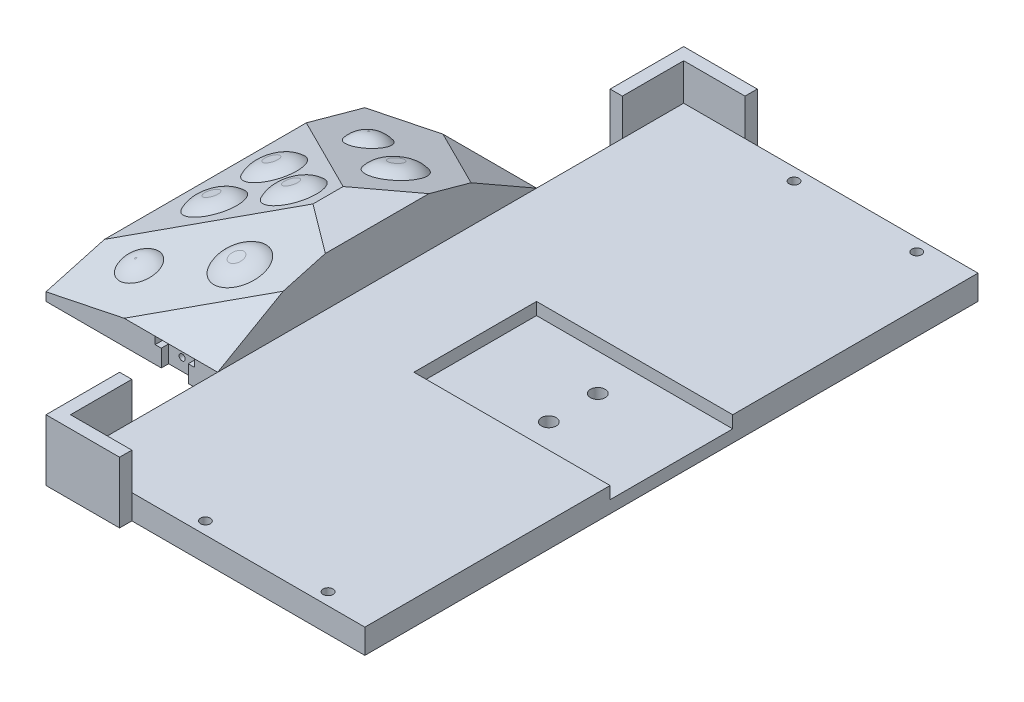
from build123d import *
from OCP.BRepFilletAPI import BRepFilletAPI_MakeChamfer

# Parameters (mm, degrees)
AUFSATZ_LINEAR_AUSTRAGEN1_DEPTH      = 15
SKIZZE2_W                            = 5
SKIZZE2_H                            = 4
SKIZZE2_H_2                          = 3
AUFSATZ_LINEAR_AUSTRAGEN2_DEPTH      = 37
AUFSATZ_LINEAR_AUSTRAGEN3_DEPTH      = 15
SKIZZE4_W                            = 5
SKIZZE4_H                            = 250
AUFSATZ_LINEAR_AUSTRAGEN4_DEPTH      = 15
SKIZZE5_W                            = 30
SKIZZE5_H                            = 5
AUFSATZ_LINEAR_AUSTRAGEN5_DEPTH      = 30
AUFSATZ_LINEAR_AUSTRAGEN6_DEPTH      = 15
AUFSATZ_LINEAR_AUSTRAGEN6_2_DEPTH    = 15
SKIZZE7_W                            = 5
SKIZZE7_H                            = 5
AUFSATZ_LINEAR_AUSTRAGEN7_DEPTH      = 15
AUFSATZ_LINEAR_AUSTRAGEN8_DEPTH      = 15
AUFSATZ_LINEAR_AUSTRAGEN8_DEPTH_BACK = 15
SKIZZE8_W                            = 5
SKIZZE8_H                            = 30.74644599
SKIZZE8_H_2                          = 29.008771532
SKIZZE9_W                            = 5
SKIZZE9_H                            = 5
AUFSATZ_LINEAR_AUSTRAGEN10_DEPTH     = 15
SKIZZE10_W                           = 5
SKIZZE10_H                           = 30
SCHNITT_LINEAR_AUSTRAGEN1_DEPTH      = 1.01
SKIZZE12_W                           = 10.711230156
SKIZZE12_H                           = 5
SKIZZE12_W_2                         = 5
SKIZZE12_H_2                         = 5.74644599
SKIZZE12_H_3                         = 4.008771532
SKIZZE12_W_3                         = 18.406645612
SKIZZE12_H_4                         = 11.130363441
SKIZZE12_W_4                         = 9.588104439
SKIZZE12_H_5                         = 13.193622238
SCHNITT_LINEAR_AUSTRAGEN2_DEPTH      = 15
SKIZZE13_W                           = 10.711230156
SKIZZE13_H                           = 5
SKIZZE13_W_2                         = 9.588104439
SKIZZE13_W_3                         = 5
SKIZZE13_H_2                         = 13.193622238
SKIZZE13_H_3                         = 11.130363441
SKIZZE13_W_4                         = 18.406645612
SCHNITT_LINEAR_AUSTRAGEN3_DEPTH      = 15
SKIZZE14_W                           = 50
SKIZZE14_H                           = 50
SKIZZE14_W_2                         = 20
AUFSATZ_LINEAR_AUSTRAGEN11_DEPTH     = 20
FASE2_SIZE                           = 20
FASE2_SIZE2                          = 50
FASE3_SIZE                           = 20
FASE3_SIZE2                          = 35
FASE4_SIZE                           = 20
SKIZZE15_R                           = 10
SKIZZE15_R_2                         = 7.5
AUFSATZ_LINEAR_AUSTRAGEN12_DEPTH     = 3
VERRUNDUNG1_R                        = 10
SKIZZE18_R                           = 10
SKIZZE18_R_2                         = 7.5
AUFSATZ_LINEAR_AUSTRAGEN13_DEPTH     = 3
VERRUNDUNG2_R                        = 10
SKIZZE19_R                           = 10
AUFSATZ_LINEAR_AUSTRAGEN14_DEPTH     = 3
VERRUNDUNG3_R                        = 10
SKIZZE20_R                           = 1.5
SCHNITT_LINEAR_AUSTRAGEN4_DEPTH      = 250
SKIZZE21_W                           = 4
SKIZZE21_H                           = 7
SKIZZE21_H_2                         = 5.2
SKIZZE21_W_2                         = 41
AUFSATZ_LINEAR_AUSTRAGEN15_DEPTH     = 10
SKIZZE22_R                           = 1.75
SCHNITT_LINEAR_AUSTRAGEN5_DEPTH      = 20
SCHNITT_LINEAR_AUSTRAGEN8_DEPTH      = 50
SCHNITT_LINEAR_AUSTRAGEN8_DEPTH_BACK = 50
SKIZZE25_W                           = 212.967285893
SKIZZE25_H                           = 303.234570009
SKIZZE26_W                           = 50
SKIZZE26_H                           = 5
SCHNITT_LINEAR_AUSTRAGEN9_DEPTH      = 80
SKIZZE28_R                           = 12.5
SCHNITT_LINEAR_AUSTRAGEN10_DEPTH     = 80
SKIZZE29_R                           = 23.129558289
AUFSATZ_LINEAR_AUSTRAGEN16_DEPTH     = 10
SKIZZE33_W                           = 50
SKIZZE33_H                           = 5
AUFSATZ_LINEAR_AUSTRAGEN17_DEPTH     = 160
SKIZZE34_W                           = 160
SKIZZE34_H                           = 50
AUFSATZ_LINEAR_AUSTRAGEN18_DEPTH     = 15
SKIZZE36_R                           = 2.5
SCHNITT_LINEAR_AUSTRAGEN12_DEPTH     = 250
SKIZZE37_R                           = 3
SCHNITT_LINEAR_AUSTRAGEN16_DEPTH     = 78
SKIZZE38_R                           = 2
SCHNITT_LINEAR_AUSTRAGEN17_DEPTH     = 50
SKIZZE39_W                           = 160
SKIZZE39_H                           = 50
SCHNITT_LINEAR_AUSTRAGEN18_DEPTH     = 15
SCHNITT_LINEAR_START                 = -5
SKIZZE40_W                           = 160
SKIZZE40_H                           = 50
SKIZZE40_R                           = 3
SCHNITT_LINEAR_AUSTRAGEN19_DEPTH     = 5
SKIZZE41_R                           = 3
SCHNITT_LINEAR_AUSTRAGEN22_DEPTH     = 10
SKIZZE46_W                           = 65
SKIZZE46_H                           = 5
SKIZZE46_W_2                         = 30
SKIZZE46_W_3                         = 95
SCHNITT_LINEAR_AUSTRAGEN25_DEPTH     = 268
SKIZZE48_W                           = 7
SKIZZE48_H                           = 10
SCHNITT_LINEAR_AUSTRAGEN26_DEPTH     = 33
SKIZZE49_W                           = 7
SKIZZE49_H                           = 10
SCHNITT_LINEAR_AUSTRAGEN28_DEPTH     = 33
SKIZZE50_R                           = 1.65
SCHNITT_LINEAR_AUSTRAGEN31_DEPTH     = 7
SKIZZE52_R                           = 7.40510693
SKIZZE52_R_2                         = 8.306038869
AUFSATZ_LINEAR_AUSTRAGEN31_DEPTH     = 17
SKIZZE53_W                           = 20.840230673
SKIZZE53_H                           = 124
AUFSATZ_LINEAR_AUSTRAGEN34_DEPTH     = 10
SKIZZE54_W                           = 9.5
SKIZZE54_H                           = 3
SKIZZE54_W_2                         = 2.5
SCHNITT_LINEAR_AUSTRAGEN32_DEPTH     = 3
SKIZZE55_W                           = 2.5
SKIZZE55_H                           = 3
SCHNITT_LINEAR_AUSTRAGEN34_DEPTH     = 6
SKIZZE57_R                           = 1.25
SCHNITT_LINEAR_AUSTRAGEN35_DEPTH     = 131
SKIZZE58_W                           = 30.500290538
SKIZZE58_H                           = 110
AUFSATZ_LINEAR_AUSTRAGEN35_DEPTH     = 10
SKIZZE59_R                           = 1.65
SCHNITT_LINEAR_AUSTRAGEN36_DEPTH     = 10
SKIZZE60_W                           = 2
SKIZZE60_H                           = 7
SKIZZE60_H_2                         = 3
SCHNITT_LINEAR_AUSTRAGEN40_DEPTH     = 36
SKIZZE61_W                           = 2
SKIZZE61_H                           = 7
SKIZZE61_H_2                         = 3
SCHNITT_LINEAR_AUSTRAGEN41_DEPTH     = 3


with BuildPart() as part:
    # Skizze1 → Aufsatz-Linear austragen1 (new body)
    with BuildSketch(Plane(origin=(0, 0, 0), x_dir=(1, 0, 0), z_dir=(0, 1, 0))):
        Polygon((-105, 65), (-175, 65), (-175, -65), (-105, -65), (-105, -125), (145, -125), (185, -20), (175, -20), (175, 0), (175, 20), (185, 20), (145, 125), (-105, 125), align=None)
        Polygon((175, 0), (175, 20), (185, 20), (185, 0), (185, -20), (175, -20), align=None)
    extrude(amount=AUFSATZ_LINEAR_AUSTRAGEN1_DEPTH)

    # Skizze2 → Aufsatz-Linear austragen2 (add)
    with BuildSketch(Plane(origin=(0, 15, 0), x_dir=(1, 0, 0), z_dir=(0, 1, 0))):
        with Locations((-122.5, -40)):
            Rectangle(SKIZZE2_W, SKIZZE2_H)
        with Locations((-122.5, 40)):
            Rectangle(SKIZZE2_W, SKIZZE2_H)
        with Locations((-122.5, 63.5)):
            Rectangle(SKIZZE2_W, SKIZZE2_H_2)
        with Locations((-122.5, -63.5)):
            Rectangle(SKIZZE2_W, SKIZZE2_H_2)
    extrude(amount=-AUFSATZ_LINEAR_AUSTRAGEN2_DEPTH)

    # Skizze3 → Aufsatz-Linear austragen3 (add)
    with BuildSketch(Plane(origin=(0, 15, 0), x_dir=(1, 0, 0), z_dir=(0, 1, 0))):
        Polygon((145, -125), (195, -125), (195, 125), (145, 125), (185, 20), (185, -20), align=None)
    extrude(amount=-AUFSATZ_LINEAR_AUSTRAGEN3_DEPTH)

    # Skizze4 → Aufsatz-Linear austragen4 (add)
    with BuildSketch(Plane(origin=(0, 15, 0), x_dir=(1, 0, 0), z_dir=(0, 1, 0))):
        with Locations((197.5, 0)):
            Rectangle(SKIZZE4_W, SKIZZE4_H)
    extrude(amount=-AUFSATZ_LINEAR_AUSTRAGEN4_DEPTH)

    # Skizze5 → Aufsatz-Linear austragen5 (add)
    with BuildSketch(Plane(origin=(0, 15, 0), x_dir=(1, 0, 0), z_dir=(0, 1, 0))):
        with Locations((-90, 122.5)):
            Rectangle(SKIZZE5_W, SKIZZE5_H)
        with Locations((-90, -122.5)):
            Rectangle(SKIZZE5_W, SKIZZE5_H)
    extrude(amount=-AUFSATZ_LINEAR_AUSTRAGEN5_DEPTH)



with BuildPart() as body_2:
    # Skizze6 → Aufsatz-Linear austragen6 (new body)
    with BuildSketch(Plane(origin=(0, 15, 0), x_dir=(1, 0, 0), z_dir=(0, 1, 0))):
        Polygon((-61.593354388, 130), (-110, 130), (-110, 88.869636559), (-105, 88.869636559), (-105, 125), (-61.593354388, 125), align=None)
    extrude(amount=AUFSATZ_LINEAR_AUSTRAGEN6_DEPTH)


with BuildPart() as body_3:
    # Skizze6 → Aufsatz-Linear austragen6 2 (new body)
    with BuildSketch(Plane(origin=(0, 15, 0), x_dir=(1, 0, 0), z_dir=(0, 1, 0))):
        Polygon((-110, -86.806377762), (-110, -130), (-70.411895561, -130), (-70.411895561, -125), (-105, -125), (-105, -86.806377762), align=None)
    extrude(amount=AUFSATZ_LINEAR_AUSTRAGEN6_2_DEPTH)


with BuildPart() as part_1:
    add(part.part)

    add(body_2.part)  # Aufsatz-Linear austragen7 merges body 2

    add(body_3.part)  # Aufsatz-Linear austragen7 merges body 3
    # Skizze7 → Aufsatz-Linear austragen7 (add)
    with BuildSketch(Plane.XZ):
        Polygon((-110, -88.869636559), (-110, -125), (-105, -125), (-105, -120), (-105, -88.869636559), align=None)
        with Locations((-107.5, -127.5)):
            Rectangle(SKIZZE7_W, SKIZZE7_H)
        Polygon((-105, -125), (-105, -130), (-61.593354388, -130), (-61.593354388, -125), (-75, -125), align=None)
        Polygon((-105, 125), (-110, 125), (-110, 86.806377762), (-105, 86.806377762), (-105, 120), align=None)
        with Locations((-107.5, 127.5)):
            Rectangle(SKIZZE7_W, SKIZZE7_H)
        Polygon((-70.411895561, 130), (-105, 130), (-105, 125), (-75, 125), (-70.411895561, 125), align=None)
    extrude(amount=-AUFSATZ_LINEAR_AUSTRAGEN7_DEPTH)

    # Skizze8 → Aufsatz-Linear austragen8 (add, two sides: drawn at the far end of the back side and taken through both)
    with BuildSketch(Plane(origin=(0, 15, 0), x_dir=(1, 0, 0), z_dir=(0, 1, 0)).offset(-AUFSATZ_LINEAR_AUSTRAGEN8_DEPTH_BACK)):
        with Locations((147.5, -109.626777005)):
            Rectangle(SKIZZE8_W, SKIZZE8_H)
        Polygon((145, -125), (109.288769844, -125), (109.288769844, -130), (150, -130), (150, -125), align=None)
        with Locations((147.5, 110.495614234)):
            Rectangle(SKIZZE8_W, SKIZZE8_H_2)
        Polygon((118.994620346, 130), (118.994620346, 125), (145, 125), (150, 125), (150, 130), align=None)
    extrude(amount=AUFSATZ_LINEAR_AUSTRAGEN8_DEPTH + AUFSATZ_LINEAR_AUSTRAGEN8_DEPTH_BACK)

    # Skizze9 → Aufsatz-Linear austragen10 (add)
    with BuildSketch(Plane(origin=(0, 15, 0), x_dir=(1, 0, 0), z_dir=(0, 1, 0))):
        Polygon((145, 4), (150, 4), (150, 9), (150, 14), (145, 14), align=None)
        with Locations((152.5, 6.5)):
            Rectangle(SKIZZE9_W, SKIZZE9_H)
        Polygon((190, 4), (200, 4), (200, 14), (196, 14), (196, 9), (190, 9), align=None)
        Polygon((196, 105), (200, 105), (200, 125), (150, 125), (150, 120), (196, 120), align=None)
    extrude(amount=AUFSATZ_LINEAR_AUSTRAGEN10_DEPTH)

    # Skizze10 → Schnitt-Linear austragen1 (cut)
    with BuildSketch(Plane.ZY.offset(-118.994620346)):
        with Locations((-127.5, 15)):
            Rectangle(SKIZZE10_W, SKIZZE10_H)
    extrude(amount=-SCHNITT_LINEAR_AUSTRAGEN1_DEPTH, mode=Mode.SUBTRACT)

    # Skizze12 → Schnitt-Linear austragen2 (cut)
    with BuildSketch(Plane(origin=(0, 15, 0), x_dir=(1, 0, 0), z_dir=(0, 1, 0))):
        with Locations((114.644384922, -127.5)):
            Rectangle(SKIZZE12_W, SKIZZE12_H)
        with Locations((147.5, -97.126777005)):
            Rectangle(SKIZZE12_W_2, SKIZZE12_H_2)
        with Locations((147.5, 97.995614234)):
            Rectangle(SKIZZE12_W_2, SKIZZE12_H_3)
        with Locations((-70.796677194, 127.5)):
            Rectangle(SKIZZE12_W_3, SKIZZE12_H)
        with Locations((-107.5, 94.43481828)):
            Rectangle(SKIZZE12_W_2, SKIZZE12_H_4)
        with Locations((-75.20594778, -127.5)):
            Rectangle(SKIZZE12_W_4, SKIZZE12_H)
        with Locations((-107.5, -93.403188881)):
            Rectangle(SKIZZE12_W_2, SKIZZE12_H_5)
    extrude(amount=SCHNITT_LINEAR_AUSTRAGEN2_DEPTH, mode=Mode.SUBTRACT)

    # Skizze13 → Schnitt-Linear austragen3 (cut)
    with BuildSketch(Plane(origin=(0, 15, 0), x_dir=(1, 0, 0), z_dir=(0, 1, 0))):
        with Locations((114.644384922, -127.5)):
            Rectangle(SKIZZE13_W, SKIZZE13_H)
        with Locations((-75.20594778, -127.5)):
            Rectangle(SKIZZE13_W_2, SKIZZE13_H)
        with Locations((-107.5, -93.403188881)):
            Rectangle(SKIZZE13_W_3, SKIZZE13_H_2)
        with Locations((-107.5, 94.43481828)):
            Rectangle(SKIZZE13_W_3, SKIZZE13_H_3)
        with Locations((-70.796677194, 127.5)):
            Rectangle(SKIZZE13_W_4, SKIZZE13_H)
    extrude(amount=-SCHNITT_LINEAR_AUSTRAGEN3_DEPTH, mode=Mode.SUBTRACT)

    # Skizze14 → Aufsatz-Linear austragen11 (add)
    with BuildSketch(Plane(origin=(0, 15, 0), x_dir=(1, 0, 0), z_dir=(0, 1, 0))):
        Polygon((-175, -25), (-175, -65), (-105, -65), (-105, -25), (-125, -25), align=None)
        with Locations((-150, 0)):
            Rectangle(SKIZZE14_W, SKIZZE14_H)
        with Locations((-115, 0)):
            Rectangle(SKIZZE14_W_2, SKIZZE14_H)
        Polygon((-175, 65), (-175, 25), (-125, 25), (-105, 25), (-105, 65), align=None)
    extrude(amount=AUFSATZ_LINEAR_AUSTRAGEN11_DEPTH)

    # Fase2
    fase2_edges = [part_1.edges().sort_by_distance(p)[0] for p in [
        (-175, 35, 0),
    ]]
    fase2_side = [part_1.faces().sort_by_distance(p)[0] for p in [
        (-175, 17.5, 0),
    ]]
    chamfer(fase2_edges, length=FASE2_SIZE, length2=FASE2_SIZE2, reference=fase2_side[0])

    # Fase3: one chamfer whose edges measure the first distance from different faces: ONE call of the kernel's chamfer builder (chamfer() names one face for all edges)
    fase3_edges_1 = [part_1.edges().sort_by_distance(p)[0] for p in [
        (-115, 35, -65),
    ]]
    fase3_side_1 = [part_1.faces().sort_by_distance(p)[0] for p in [
        (-134.615695793, 13.348705502, -65),
    ]]
    fase3_edges_2 = [part_1.edges().sort_by_distance(p)[0] for p in [
        (-115, 35, 65),
    ]]
    fase3_side_2 = [part_1.faces().sort_by_distance(p)[0] for p in [
        (-134.615695793, 13.348705502, 65),
    ]]
    fase3 = BRepFilletAPI_MakeChamfer(part_1.part.solid().wrapped)
    for e in fase3_edges_1:
        fase3.Add(FASE3_SIZE, FASE3_SIZE2, e.wrapped, fase3_side_1[0].wrapped)  # the first distance lies on this face
    for e in fase3_edges_2:
        fase3.Add(FASE3_SIZE, FASE3_SIZE2, e.wrapped, fase3_side_2[0].wrapped)  # the first distance lies on this face
    add(Compound.cast(fase3.Shape()), mode=Mode.REPLACE)

    # Fase4
    fase4_edges = [part_1.edges().sort_by_distance(p)[0] for p in [
        (-150, 25, 47.5),
        (-150, 25, -47.5),
    ]]
    chamfer(fase4_edges, length=FASE4_SIZE)

    # Skizze15 → Aufsatz-Linear austragen12 (add)
    with BuildSketch(Plane(origin=(-11.551963806, 55.886277719, -15.432210402), x_dir=(0.9807222582245502, 0.18835756766165584, -0.05201229592628623), z_dir=(-0.19540688888301463, 0.9453426139004438, -0.2610430809673718))):
        with Locations(Location((-117.284914164, 20.601047932, 0), (0, 0, 270))):
            Circle(SKIZZE15_R)
        with Locations(Location((-142.839757147, 36.315690789, 0), (0, 0, 270))):
            Circle(SKIZZE15_R_2)
    extrude(amount=AUFSATZ_LINEAR_AUSTRAGEN12_DEPTH)

    # Verrundung1
    # the kernel refuses this fillet: 10 mm, written as the material it takes off along each edge
    with BuildSketch(Plane(origin=(-127.162110348, 31.147334465, -29.972945243), x_dir=(0, 0.26617432079083353, 0.963924909394678), z_dir=(-0.9807222582245501, -0.18835756766165582, 0.052012295926286305))) as verrundung1_piece_1:
        with BuildLine():
            CenterArc((2.858571571, -10), VERRUNDUNG1_R, 44.427004001, 45.572995999)
            Line((2.858571571, 0), (2.858571571, 0.2))
            Line((2.858571571, 0.2), (10, 0.2))
            Line((10, 0.2), (10.2, 0))
            ThreePointArc((10.2, 0), (10.2, -1.5), (10.142828569, -2.86))
            Line((10.142828569, -2.86), (10, -3))
        make_face()
    revolve(axis=Axis((-127.162110348, 31.147334465, -29.972945243), (-0.19540688888301466, 0.9453426139004438, -0.2610430809673718)), mode=Mode.SUBTRACT)
    with BuildSketch(Plane(origin=(-152.224313666, 22.15105201, -43.791514879), x_dir=(0, 0.26617432079083364, 0.9639249093946781), z_dir=(-0.9807222582245503, -0.18835756766165584, 0.052012295926286325))) as verrundung1_piece_2:
        with BuildLine():
            CenterArc((0.358571571, -10), VERRUNDUNG1_R, 44.427004001, 45.572995999)
            Line((0.358571571, 0), (0.358571571, 0.2))
            Line((0.358571571, 0.2), (7.5, 0.2))
            Line((7.5, 0.2), (7.7, 0))
            ThreePointArc((7.7, 0), (7.7, -1.5), (7.642828569, -2.86))
            Line((7.642828569, -2.86), (7.5, -3))
        make_face()
    revolve(axis=Axis((-152.224313666, 22.15105201, -43.791514879), (-0.19540688888301466, 0.9453426139004438, -0.2610430809673718)), mode=Mode.SUBTRACT)

    # Skizze18 → Aufsatz-Linear austragen13 (add)
    with BuildSketch(Plane(origin=(-11.551963806, 55.886277719, 15.432210402), x_dir=(0.9807222582245502, 0.18835756766165587, 0.05201229592628629), z_dir=(-0.19540688888301466, 0.9453426139004437, 0.261043080967372))):
        with Locations(Location((-117.284914164, -25.97894302, 0), (0, 0, 270))):
            Circle(SKIZZE18_R)
        with Locations(Location((-147.284914164, -39.72137923, 0), (0, 0, 270))):
            Circle(SKIZZE18_R_2)
    extrude(amount=AUFSATZ_LINEAR_AUSTRAGEN13_DEPTH)

    # Verrundung2
    # the kernel refuses this fillet: 10 mm, written as the material it takes off along each edge
    with BuildSketch(Plane(origin=(-127.162110348, 29.715876892, 35.156832279), x_dir=(0, -0.26617432079083353, 0.963924909394678), z_dir=(-0.98072225822455, -0.1883575676616558, -0.0520122959262863))) as verrundung2_piece_1:
        with BuildLine():
            CenterArc((2.858571571, -10), VERRUNDUNG2_R, 44.427004001, 45.572995999)
            Line((2.858571571, 0), (2.858571571, 0.2))
            Line((2.858571571, 0.2), (10, 0.2))
            Line((10, 0.2), (10.2, 0))
            ThreePointArc((10.2, 0), (10.2, -1.5), (10.142828569, -2.86))
            Line((10.142828569, -2.86), (10, -3))
        make_face()
    revolve(axis=Axis((-127.162110348, 29.715876892, 35.156832279), (-0.19540688888301463, 0.9453426139004436, 0.26104308096737205)), mode=Mode.SUBTRACT)
    with BuildSketch(Plane(origin=(-156.583778094, 20.407266239, 46.843139979), x_dir=(0, -0.26617432079083425, 0.9639249093946779), z_dir=(-0.9807222582245501, -0.18835756766165576, -0.05201229592628644))) as verrundung2_piece_2:
        with BuildLine():
            CenterArc((0.358571571, -10), VERRUNDUNG2_R, 44.427004001, 45.572995999)
            Line((0.358571571, 0), (0.358571571, 0.2))
            Line((0.358571571, 0.2), (7.5, 0.2))
            Line((7.5, 0.2), (7.7, 0))
            ThreePointArc((7.7, 0), (7.7, -1.5), (7.642828569, -2.86))
            Line((7.642828569, -2.86), (7.5, -3))
        make_face()
    revolve(axis=Axis((-156.583778094, 20.407266239, 46.843139979), (-0.19540688888301463, 0.9453426139004436, 0.26104308096737205)), mode=Mode.SUBTRACT)

    # Skizze19 → Aufsatz-Linear austragen14 (add)
    with BuildSketch(Plane(origin=(-29.310344828, 73.275862069, 0), x_dir=(0.9284766908852605, 0.371390676354101, 0), z_dir=(-0.371390676354101, 0.9284766908852605, 0))):
        with Locations(Location((-118.060912688, -0.063197478, 0), (0, 0, 180))):
            Circle(SKIZZE19_R)
        with Locations(Location((-139.860763151, 12.174715734, 0), (0, 0, 180))):
            Circle(SKIZZE19_R)
        with Locations(Location((-139.91256076, -12.208380744, 0), (0, 0, 180))):
            Circle(SKIZZE19_R)
    extrude(amount=AUFSATZ_LINEAR_AUSTRAGEN14_DEPTH)

    # Verrundung3
    # the kernel refuses this fillet: 10 mm, written as the material it takes off along each edge
    with BuildSketch(Plane(origin=(-140.041322392, 32.214569927, 0.063197478), x_dir=(-0.9284766908852606, -0.37139067635410067, 0), z_dir=(0, 0, -1))) as verrundung3_piece_1:
        with BuildLine():
            CenterArc((2.858571571, -10), VERRUNDUNG3_R, 44.427004001, 45.572995999)
            Line((2.858571571, 0), (2.858571571, 0.2))
            Line((2.858571571, 0.2), (10, 0.2))
            Line((10, 0.2), (10.2, 0))
            ThreePointArc((10.2, 0), (10.2, -1.5), (10.142828569, -2.86))
            Line((10.142828569, -2.86), (10, -3))
        make_face()
    revolve(axis=Axis((-140.041322392, 32.214569927, 0.063197478), (-0.371390676354101, 0.9284766908852605, 0)), mode=Mode.SUBTRACT)
    with BuildSketch(Plane(origin=(-160.281975412, 24.11830872, -12.174715734), x_dir=(-0.9284766908852602, -0.37139067635410167, 0), z_dir=(0, 0, -1))) as verrundung3_piece_2:
        with BuildLine():
            CenterArc((2.858571571, -10), VERRUNDUNG3_R, 44.427004001, 45.572995999)
            Line((2.858571571, 0), (2.858571571, 0.2))
            Line((2.858571571, 0.2), (10, 0.2))
            Line((10, 0.2), (10.2, 0))
            ThreePointArc((10.2, 0), (10.2, -1.5), (10.142828569, -2.86))
            Line((10.142828569, -2.86), (10, -3))
        make_face()
    revolve(axis=Axis((-160.281975412, 24.11830872, -12.174715734), (-0.371390676354101, 0.9284766908852605, 0)), mode=Mode.SUBTRACT)
    with BuildSketch(Plane(origin=(-160.330068284, 24.099071571, 12.208380744), x_dir=(-0.9284766908852602, -0.37139067635410167, 0), z_dir=(0, 0, -1))) as verrundung3_piece_3:
        with BuildLine():
            CenterArc((2.858571571, -10), VERRUNDUNG3_R, 44.427004001, 45.572995999)
            Line((2.858571571, 0), (2.858571571, 0.2))
            Line((2.858571571, 0.2), (10, 0.2))
            Line((10, 0.2), (10.2, 0))
            ThreePointArc((10.2, 0), (10.2, -1.5), (10.142828569, -2.86))
            Line((10.142828569, -2.86), (10, -3))
        make_face()
    revolve(axis=Axis((-160.330068284, 24.099071571, 12.208380744), (-0.371390676354101, 0.9284766908852605, 0)), mode=Mode.SUBTRACT)

    # Skizze20 → Schnitt-Linear austragen4 (cut)
    with BuildSketch(Plane(origin=(0, 0, -65), x_dir=(-1, 0, 0), z_dir=(0, 0, -1))):
        with Locations(Location((122.5, -19.5, 0), (0, 0, 180))):
            Circle(SKIZZE20_R)
        with Locations(Location((122.5, -2.5, 0), (0, 0, 180))):
            Circle(SKIZZE20_R)
    extrude(amount=-SCHNITT_LINEAR_AUSTRAGEN4_DEPTH, mode=Mode.SUBTRACT)

    # Skizze21 → Aufsatz-Linear austragen15 (add)
    with BuildSketch(Plane(origin=(0, 15, 0), x_dir=(1, 0, 0), z_dir=(0, 1, 0))):
        Polygon((145, -100), (150, -100), (191, -100), (191, -93), (145, -93), align=None)
        with Locations((193, -96.5)):
            Rectangle(SKIZZE21_W, SKIZZE21_H)
        with Locations((193, -102.6)):
            Rectangle(SKIZZE21_W, SKIZZE21_H_2)
        with Locations((170.5, -121.5)):
            Rectangle(SKIZZE21_W_2, SKIZZE21_H)
        with Locations((193, -121.5)):
            Rectangle(SKIZZE21_W, SKIZZE21_H)
        with Locations((193, -115.4)):
            Rectangle(SKIZZE21_W, SKIZZE21_H_2)
    extrude(amount=AUFSATZ_LINEAR_AUSTRAGEN15_DEPTH)

    # Skizze22 → Schnitt-Linear austragen5 (cut)
    with BuildSketch(Plane(origin=(0, 15, 0), x_dir=(1, 0, 0), z_dir=(0, 1, 0))):
        with Locations(Location((146.069548912, -58.232980191, 0), (0, 0, 270))):
            Circle(SKIZZE22_R)
        with Locations(Location((146.069548912, -13.432980191, 0), (0, 0, 270))):
            Circle(SKIZZE22_R)
        with Locations(Location((185.869548912, -58.232980191, 0), (0, 0, 270))):
            Circle(SKIZZE22_R)
        with Locations(Location((185.869548912, -13.432980191, 0), (0, 0, 270))):
            Circle(SKIZZE22_R)
    extrude(amount=-SCHNITT_LINEAR_AUSTRAGEN5_DEPTH, mode=Mode.SUBTRACT)

    # Skizze25 → Schnitt-Linear austragen8 (cut, two sides: drawn at the far end of the back side and taken through both)
    with BuildSketch(Plane(origin=(0, 15, 0), x_dir=(1, 0, 0), z_dir=(0, 1, 0)).offset(-SCHNITT_LINEAR_AUSTRAGEN8_DEPTH_BACK)):
        with Locations((121.483642947, -4.738977069)):
            Rectangle(SKIZZE25_W, SKIZZE25_H)
    extrude(amount=SCHNITT_LINEAR_AUSTRAGEN8_DEPTH + SCHNITT_LINEAR_AUSTRAGEN8_DEPTH_BACK, mode=Mode.SUBTRACT)

    # Skizze26 → Schnitt-Linear austragen9 (cut)
    with BuildSketch(Plane(origin=(15, 0, 0), x_dir=(0, 0, -1), z_dir=(1, 0, 0))):
        with Locations((0, 12.5)):
            Rectangle(SKIZZE26_W, SKIZZE26_H)
    extrude(amount=-SCHNITT_LINEAR_AUSTRAGEN9_DEPTH, mode=Mode.SUBTRACT)

    # Skizze28 → Schnitt-Linear austragen10 (cut)
    with BuildSketch(Plane(origin=(0, 10, 0), x_dir=(1, 0, 0), z_dir=(0, 1, 0))):
        with Locations(Location((-35, 0, 0), (0, 0, 270))):
            Circle(SKIZZE28_R)
    extrude(amount=-SCHNITT_LINEAR_AUSTRAGEN10_DEPTH, mode=Mode.SUBTRACT)

    # Skizze29 → Aufsatz-Linear austragen16 (add)
    with BuildSketch(Plane(origin=(0, 0, 0), x_dir=(-1, 0, 0), z_dir=(0, -1, 0))):
        with Locations((35, 0)):
            Circle(SKIZZE29_R)
    extrude(amount=-AUFSATZ_LINEAR_AUSTRAGEN16_DEPTH)

    # Skizze33 → Aufsatz-Linear austragen17 (add)
    with BuildSketch(Plane(origin=(-65, 0, 0), x_dir=(0, 0, -1), z_dir=(1, 0, 0))):
        with Locations((0, 12.5)):
            Rectangle(SKIZZE33_W, SKIZZE33_H)
    extrude(amount=AUFSATZ_LINEAR_AUSTRAGEN17_DEPTH)

    # Skizze34 → Aufsatz-Linear austragen18 (add)
    with BuildSketch(Plane(origin=(0, 0, 0), x_dir=(-1, 0, 0), z_dir=(0, -1, 0))):
        with Locations((-15, 0)):
            Rectangle(SKIZZE34_W, SKIZZE34_H)
    extrude(amount=AUFSATZ_LINEAR_AUSTRAGEN18_DEPTH)

    # Skizze36 → Schnitt-Linear austragen12 (cut)
    with BuildSketch(Plane.XY.offset(125)):
        with Locations((-97.5, -7.5)):
            Circle(SKIZZE36_R)
        with Locations((-82.5, -7.5)):
            Circle(SKIZZE36_R)
    extrude(amount=-SCHNITT_LINEAR_AUSTRAGEN12_DEPTH, mode=Mode.SUBTRACT)

    # Skizze37 → Schnitt-Linear austragen16 (cut)
    with BuildSketch(Plane(origin=(0, 15, 0), x_dir=(1, 0, 0), z_dir=(0, 1, 0))):
        with Locations(Location((35, -10, 0), (0, 0, 270))):
            Circle(SKIZZE37_R)
        with Locations(Location((35, 10, 0), (0, 0, 270))):
            Circle(SKIZZE37_R)
        with Locations(Location((75, -10, 0), (0, 0, 270))):
            Circle(SKIZZE37_R)
        with Locations(Location((75, 10, 0), (0, 0, 270))):
            Circle(SKIZZE37_R)
    extrude(amount=-SCHNITT_LINEAR_AUSTRAGEN16_DEPTH, mode=Mode.SUBTRACT)

    # Skizze38 → Schnitt-Linear austragen17 (cut)
    with BuildSketch(Plane(origin=(0, 15, 0), x_dir=(1, 0, 0), z_dir=(0, 1, 0))):
        with Locations(Location((-55, -120, 0), (0, 0, 270))):
            Circle(SKIZZE38_R)
        with Locations(Location((-5, -120, 0), (0, 0, 270))):
            Circle(SKIZZE38_R)
        with Locations(Location((-5, 120, 0), (0, 0, 270))):
            Circle(SKIZZE38_R)
        with Locations(Location((-55, 120, 0), (0, 0, 270))):
            Circle(SKIZZE38_R)
    extrude(amount=-SCHNITT_LINEAR_AUSTRAGEN17_DEPTH, mode=Mode.SUBTRACT)

    # Skizze39 → Schnitt-Linear austragen18 (cut)
    with BuildSketch(Plane(origin=(0, -15, 0), x_dir=(-1, 0, 0), z_dir=(0, -1, 0))):
        with Locations((-15, 0)):
            Rectangle(SKIZZE39_W, SKIZZE39_H)
    extrude(amount=-SCHNITT_LINEAR_AUSTRAGEN18_DEPTH, mode=Mode.SUBTRACT)

    # Skizze40 → Schnitt-Linear austragen19 (cut)
    with BuildSketch(Plane.XZ.offset(-10).offset(SCHNITT_LINEAR_START)):
        with Locations((15, 0)):
            Rectangle(SKIZZE40_W, SKIZZE40_H)
        with Locations((35, -10)):
            Circle(SKIZZE40_R, mode=Mode.SUBTRACT)
        with Locations((75, -10)):
            Circle(SKIZZE40_R, mode=Mode.SUBTRACT)
    extrude(amount=SCHNITT_LINEAR_AUSTRAGEN19_DEPTH, mode=Mode.SUBTRACT)

    # Skizze41 → Schnitt-Linear austragen22 (cut)
    with BuildSketch(Plane(origin=(0, 10, 0), x_dir=(1, 0, 0), z_dir=(0, 1, 0))):
        with Locations(Location((-25, -10, 0), (0, 0, 270))):
            Circle(SKIZZE41_R)
        with Locations(Location((-25, 10, 0), (0, 0, 270))):
            Circle(SKIZZE41_R)
    extrude(amount=-SCHNITT_LINEAR_AUSTRAGEN22_DEPTH, mode=Mode.SUBTRACT)

    # Skizze46 → Schnitt-Linear austragen25 (cut)
    with BuildSketch(Plane.XY.offset(130)):
        with Locations((-142.5, 2.5)):
            Rectangle(SKIZZE46_W, SKIZZE46_H)
        Polygon((-110, 0), (-175, 0), (-175, -27.405237196), (16.713519916, -27.405237196), (16.713519916, 5), (15, 5), (15, 0), (-80, 0), align=None)
        with Locations((-95, 2.5)):
            Rectangle(SKIZZE46_W_2, SKIZZE46_H)
        with Locations((-32.5, 2.5)):
            Rectangle(SKIZZE46_W_3, SKIZZE46_H)
    extrude(amount=-SCHNITT_LINEAR_AUSTRAGEN25_DEPTH, mode=Mode.SUBTRACT)

    # Skizze48 → Schnitt-Linear austragen26 (cut)
    with BuildSketch(Plane.XY.offset(65)):
        with Locations((-122.5, 10)):
            Rectangle(SKIZZE48_W, SKIZZE48_H)
    extrude(amount=-SCHNITT_LINEAR_AUSTRAGEN26_DEPTH, mode=Mode.SUBTRACT)

    # Skizze49 → Schnitt-Linear austragen28 (cut)
    with BuildSketch(Plane(origin=(0, 0, -65), x_dir=(-1, 0, 0), z_dir=(0, 0, -1))):
        with Locations((122.5, 10)):
            Rectangle(SKIZZE49_W, SKIZZE49_H)
    extrude(amount=-SCHNITT_LINEAR_AUSTRAGEN28_DEPTH, mode=Mode.SUBTRACT)

    # Skizze50 → Schnitt-Linear austragen31 (cut)
    with BuildSketch(Plane.XZ.offset(-15)):
        with Locations(Location((-122.5, -44, 0), (0, 0, 270))):
            Circle(SKIZZE50_R)
        with Locations(Location((-122.5, 44, 0), (0, 0, 270))):
            Circle(SKIZZE50_R)
    extrude(amount=-SCHNITT_LINEAR_AUSTRAGEN31_DEPTH, mode=Mode.SUBTRACT)

    # Skizze52 → Aufsatz-Linear austragen31 (add)
    with BuildSketch(Plane.XZ.offset(-5)):
        with Locations((-123.191620095, -39.689142712)):
            Circle(SKIZZE52_R)
        with Locations((-121.44161898, 38.452211436)):
            Circle(SKIZZE52_R_2)
    extrude(amount=-AUFSATZ_LINEAR_AUSTRAGEN31_DEPTH)

    # Skizze53 → Aufsatz-Linear austragen34 (add)
    with BuildSketch(Plane.XZ.offset(-5)):
        with Locations((-120.479979011, 0)):
            Rectangle(SKIZZE53_W, SKIZZE53_H)
    extrude(amount=-AUFSATZ_LINEAR_AUSTRAGEN34_DEPTH)

    # Skizze54 → Schnitt-Linear austragen32 (cut)
    with BuildSketch(Plane(origin=(0, 0, -65), x_dir=(-1, 0, 0), z_dir=(0, 0, -1))):
        with Locations((121.25, 13.5)):
            Rectangle(SKIZZE54_W, SKIZZE54_H)
        with Locations((127.25, 13.5)):
            Rectangle(SKIZZE54_W_2, SKIZZE54_H)
    extrude(amount=-SCHNITT_LINEAR_AUSTRAGEN32_DEPTH, mode=Mode.SUBTRACT)

    # Skizze55 → Schnitt-Linear austragen34 (cut)
    with BuildSketch(Plane.XY.offset(62)):
        with Locations((-127.25, 13.5)):
            Rectangle(SKIZZE55_W, SKIZZE55_H)
        with Locations((-117.75, 13.5)):
            Rectangle(SKIZZE55_W, SKIZZE55_H)
    extrude(amount=SCHNITT_LINEAR_AUSTRAGEN34_DEPTH, mode=Mode.SUBTRACT)

    # Skizze57 → Schnitt-Linear austragen35 (cut)
    with BuildSketch(Plane(origin=(0, 0, -62), x_dir=(-1, 0, 0), z_dir=(0, 0, -1))):
        with Locations((122.5, 10)):
            Circle(SKIZZE57_R)
    extrude(amount=-SCHNITT_LINEAR_AUSTRAGEN35_DEPTH, mode=Mode.SUBTRACT)

    # Skizze58 → Aufsatz-Linear austragen35 (add)
    with BuildSketch(Plane(origin=(0, 5, 0), x_dir=(-1, 0, 0), z_dir=(0, -1, 0))):
        with Locations((123.508571453, 0)):
            Rectangle(SKIZZE58_W, SKIZZE58_H)
    extrude(amount=-AUFSATZ_LINEAR_AUSTRAGEN35_DEPTH)

    # Skizze59 → Schnitt-Linear austragen36 (cut)
    with BuildSketch(Plane.XZ.offset(-5)):
        with Locations((-122.5, -31.2)):
            Circle(SKIZZE59_R)
        with Locations((-122.5, 31.2)):
            Circle(SKIZZE59_R)
    extrude(amount=-SCHNITT_LINEAR_AUSTRAGEN36_DEPTH, mode=Mode.SUBTRACT)

    # Skizze60 → Schnitt-Linear austragen40 (cut)
    with BuildSketch(Plane(origin=(0, 0, -62), x_dir=(-1, 0, 0), z_dir=(0, 0, -1))):
        with Locations((127, 8.5)):
            Rectangle(SKIZZE60_W, SKIZZE60_H)
        with Locations((118, 8.5)):
            Rectangle(SKIZZE60_W, SKIZZE60_H)
        with Locations((115.5, 13.5)):
            Rectangle(SKIZZE60_W, SKIZZE60_H_2)
        with Locations((129.5, 13.5)):
            Rectangle(SKIZZE60_W, SKIZZE60_H_2)
    extrude(amount=SCHNITT_LINEAR_AUSTRAGEN40_DEPTH, mode=Mode.SUBTRACT)

    # Skizze61 → Schnitt-Linear austragen41 (cut)
    with BuildSketch(Plane.XY.offset(65)):
        with Locations((-127, 8.5)):
            Rectangle(SKIZZE61_W, SKIZZE61_H)
        with Locations((-118, 8.5)):
            Rectangle(SKIZZE61_W, SKIZZE61_H)
        with Locations((-115.5, 13.5)):
            Rectangle(SKIZZE61_W, SKIZZE61_H_2)
        with Locations((-129.5, 13.5)):
            Rectangle(SKIZZE61_W, SKIZZE61_H_2)
    extrude(amount=-SCHNITT_LINEAR_AUSTRAGEN41_DEPTH, mode=Mode.SUBTRACT)


solid = part_1.part
